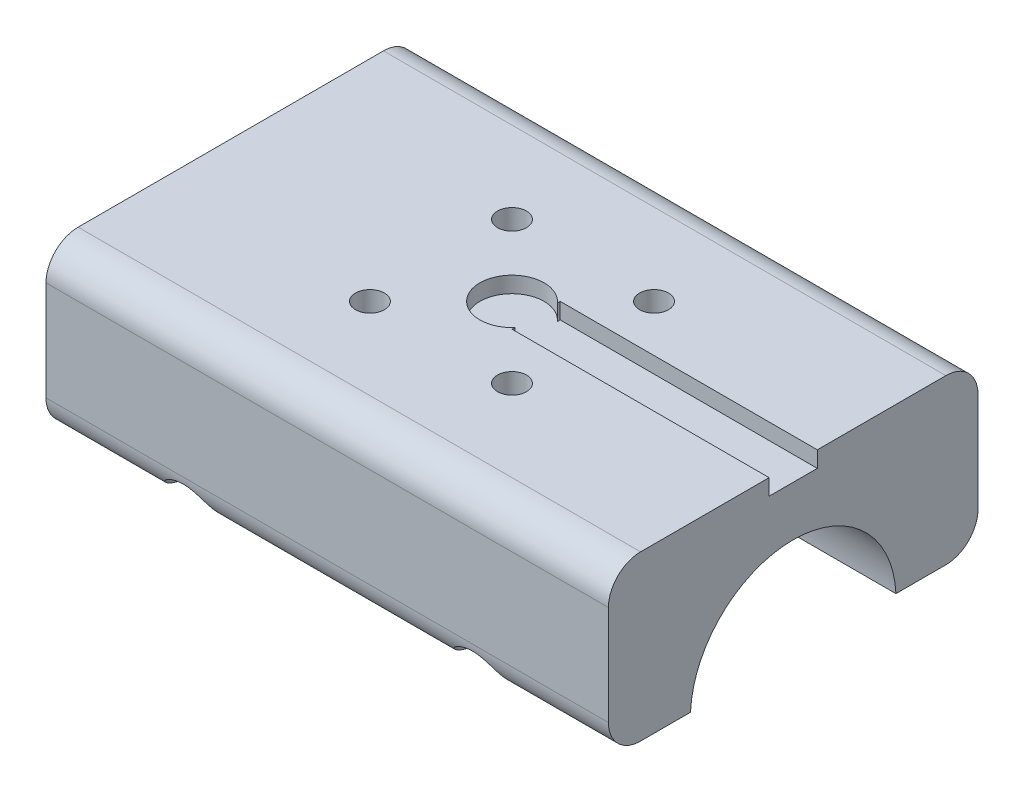
from build123d import *

# Parameters (mm, degrees)
BOSS_EXTRUDE1_DEPTH     = 35
CUT_EXTRUDE1_DEPTH      = 47.8508271
CUT_EXTRUDE1_DEPTH_BACK = 47.8508271
SKETCH2_R               = 12.8
SKETCH3_R               = 2
CUT_EXTRUDE2_DEPTH      = 7.5
SKETCH4_R               = 3.75
CUT_EXTRUDE3_DEPTH      = 16.5
SKETCH5_R               = 1.8
CUT_EXTRUDE4_DEPTH      = 22
SKETCH6_R               = 4
CUT_EXTRUDE5_DEPTH      = 2
SKETCH7_W               = 32
SKETCH7_H               = 6
CUT_EXTRUDE6_DEPTH      = 2
CUT_EXTRUDE7_DEPTH      = 47.850827224
CUT_EXTRUDE7_DEPTH_BACK = 47.850827224
SKETCH8_R               = 1.8
SKETCH9_R               = 3.75
CUT_EXTRUDE8_DEPTH      = 5
CUT_EXTRUDE9_DEPTH      = 8


with BuildPart() as part:
    # Sketch1 → Boss-Extrude1 (new, symmetric)
    with BuildSketch(Plane(origin=(0, 0, 0), x_dir=(0, 0, -1), z_dir=(1, 0, 0))):
        with BuildLine():
            Line((-19, 0.6), (19, 0.6))
            ThreePointArc((19, 0.6), (21.828427125, 1.771572875), (23, 4.6))
            Line((23, 4.6), (23, 17))
            ThreePointArc((23, 17), (21.828427125, 19.828427125), (19, 21))
            Line((19, 21), (-19, 21))
            ThreePointArc((-19, 21), (-21.828427125, 19.828427125), (-23, 17))
            Line((-23, 17), (-23, 4.6))
            ThreePointArc((-23, 4.6), (-21.828427125, 1.771572875), (-19, 0.6))
        make_face()
    extrude(amount=BOSS_EXTRUDE1_DEPTH, both=True)

    # Sketch2 → Cut-Extrude1 (cut, two sides: drawn at the far end of the back side and taken through both)
    with BuildSketch(Plane(origin=(0, 0, 0), x_dir=(0, 0, -1), z_dir=(1, 0, 0)).offset(-CUT_EXTRUDE1_DEPTH_BACK)):
        Circle(SKETCH2_R)
    extrude(amount=CUT_EXTRUDE1_DEPTH + CUT_EXTRUDE1_DEPTH_BACK, mode=Mode.SUBTRACT)

    # Sketch3 → Cut-Extrude2 (cut)
    with BuildSketch(Plane(origin=(0, 0.6, 0), x_dir=(1, 0, 0), z_dir=(0, 1, 0))):
        with Locations((28, -17.5)):
            Circle(SKETCH3_R)
        with Locations((28, 17.5)):
            Circle(SKETCH3_R)
        with Locations((-28, -17.5)):
            Circle(SKETCH3_R)
        with Locations((-28, 17.5)):
            Circle(SKETCH3_R)
    extrude(amount=CUT_EXTRUDE2_DEPTH, mode=Mode.SUBTRACT)

    # Sketch4 → Cut-Extrude3 (cut)
    with BuildSketch(Plane(origin=(0, 0, 0), x_dir=(1, 0, 0), z_dir=(0, 1, 0))):
        with Locations((8.84, -8.84)):
            Circle(SKETCH4_R)
        with Locations((8.84, 8.84)):
            Circle(SKETCH4_R)
        with Locations((-8.84, -8.84)):
            Circle(SKETCH4_R)
        with Locations((-8.84, 8.84)):
            Circle(SKETCH4_R)
    extrude(amount=CUT_EXTRUDE3_DEPTH, mode=Mode.SUBTRACT)

    # Sketch5 → Cut-Extrude4 (cut)
    with BuildSketch(Plane(origin=(0, 0, 0), x_dir=(1, 0, 0), z_dir=(0, 1, 0))):
        with Locations((8.84, -8.84)):
            Circle(SKETCH5_R)
        with Locations((8.84, 8.84)):
            Circle(SKETCH5_R)
        with Locations((-8.84, -8.84)):
            Circle(SKETCH5_R)
        with Locations((-8.84, 8.84)):
            Circle(SKETCH5_R)
    extrude(amount=CUT_EXTRUDE4_DEPTH, mode=Mode.SUBTRACT)

    # Sketch6 → Cut-Extrude5 (cut)
    with BuildSketch(Plane(origin=(0, 21, 0), x_dir=(1, 0, 0), z_dir=(0, 1, 0))):
        Circle(SKETCH6_R)
    extrude(amount=-CUT_EXTRUDE5_DEPTH, mode=Mode.SUBTRACT)

    # Sketch7 → Cut-Extrude6 (cut)
    with BuildSketch(Plane(origin=(0, 21, 0), x_dir=(1, 0, 0), z_dir=(0, 1, 0))):
        with Locations((19, 0)):
            Rectangle(SKETCH7_W, SKETCH7_H)
    extrude(amount=-CUT_EXTRUDE6_DEPTH, mode=Mode.SUBTRACT)

    # Sketch8 → Cut-Extrude7 (cut, two sides: drawn at the far end of the back side and taken through both)
    with BuildSketch(Plane.XY.offset(-CUT_EXTRUDE7_DEPTH_BACK)):
        with Locations((18, 0)):
            Circle(SKETCH8_R)
        with Locations((-18, 0)):
            Circle(SKETCH8_R)
    extrude(amount=CUT_EXTRUDE7_DEPTH + CUT_EXTRUDE7_DEPTH_BACK, mode=Mode.SUBTRACT)

    # Sketch9 → Cut-Extrude8 (cut)
    with BuildSketch(Plane.XY.offset(23)):
        with Locations((18, 0)):
            Circle(SKETCH9_R)
        with Locations((-18, 0)):
            Circle(SKETCH9_R)
    extrude(amount=-CUT_EXTRUDE8_DEPTH, mode=Mode.SUBTRACT)

    # Sketch10 → Cut-Extrude9 (cut)
    with BuildSketch(Plane.XY.offset(-23)):
        Polygon((20.85, 1.645448267), (18, 3.290896534), (15.15, 1.645448267), (15.15, -1.645448267), (18, -3.290896534), (20.85, -1.645448267), align=None)
        Polygon((-15.15, 1.645448267), (-18, 3.290896534), (-20.85, 1.645448267), (-20.85, -1.645448267), (-18, -3.290896534), (-15.15, -1.645448267), align=None)
    extrude(amount=CUT_EXTRUDE9_DEPTH, mode=Mode.SUBTRACT)


solid = part.part
